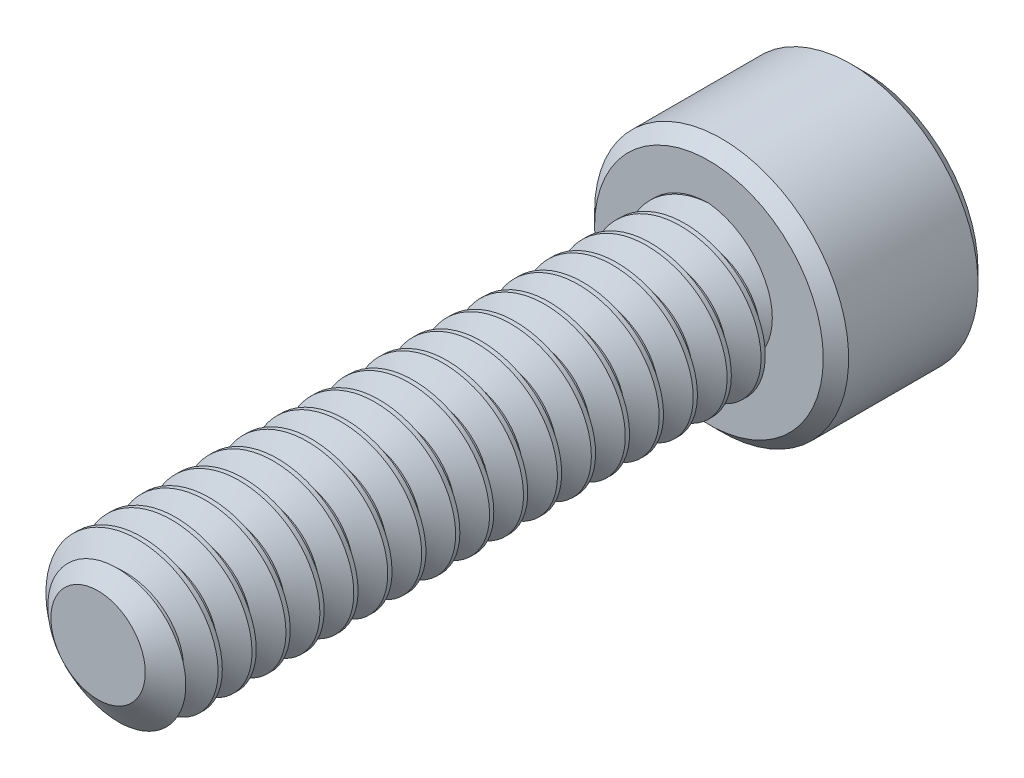
from build123d import *

# Parameters (mm, degrees)
SKETCH1_R          = 2.413
EXTRUDE1_DEPTH     = 19.05
CUT_SWEEP1_PITCH   = 1.058333333
SKETCH6_R          = 3.9624
EXTRUDE2_DEPTH     = 4.826
CUT_EXTRUDE1_DEPTH = 2.9765625
CHAMFER1_SIZE      = 0.39624


with BuildPart() as part:
    # Sketch1 → Extrude1 (new body)
    with BuildSketch(Plane.XY):
        Circle(SKETCH1_R)
    extrude(amount=-EXTRUDE1_DEPTH)

    # Cut-Sweep1: the profile of Sketch3 profile screwed along a right-hand helix of 19 turns, 6 arcs to a turn; built about Z, then put on its axis
    cut_sweep1_z = Axis((0, 0, 0), (0, 0, 1))
    cut_sweep1_corners = [(2.4133, 0, -0.926214872), (1.725592336, 0, -0.529166667), (1.725592336, 0, -0.396875), (2.4133, 0, 0.000173205)]
    with BuildLine(mode=Mode.PRIVATE) as cut_sweep1_profile:
        Line(cut_sweep1_corners[0], cut_sweep1_corners[1])
        Line(cut_sweep1_corners[1], cut_sweep1_corners[2])
        Line(cut_sweep1_corners[2], cut_sweep1_corners[3])
        Line(cut_sweep1_corners[3], cut_sweep1_corners[0])
    cut_sweep1_cap = Face(cut_sweep1_profile.wire())
    cut_sweep1_turn_angles = [0, 30, 60, 90, 120, 150, 180, 210, 240, 270, 300, 330, 360]
    cut_sweep1_turn_weights = [1, 0.8660254037844387, 1, 0.8660254037844387, 1, 0.8660254037844387, 1, 0.8660254037844387, 1, 0.8660254037844387, 1, 0.8660254037844387, 1]
    cut_sweep1_turn_rails = [Edge.make_bspline([Vector(p[0], p[1], 0).rotate(cut_sweep1_z, cut_sweep1_turn_angles[k]) / cut_sweep1_turn_weights[k] + Vector(0, 0, p[2] + CUT_SWEEP1_PITCH * cut_sweep1_turn_angles[k] / 360) for k in range(13)], [0, 0, 0, 1, 1, 2, 2, 3, 3, 4, 4, 5, 5, 6, 6, 6], 2, cut_sweep1_turn_weights) for p in cut_sweep1_corners]
    cut_sweep1_turn_sides = [Face.make_surface_from_curves(cut_sweep1_turn_rails[p[0]], cut_sweep1_turn_rails[p[1]]) for p in [(0, 1), (1, 2), (2, 3), (3, 0)]]
    cut_sweep1 = Plane(origin=(0, 0, 0), x_dir=(0, 1, 0), z_dir=(0, 0, -1)) * Solid(Shell([*[p.moved(Location((0, 0, CUT_SWEEP1_PITCH * i))) for i in range(19) for p in cut_sweep1_turn_sides], cut_sweep1_cap, cut_sweep1_cap.rotate(cut_sweep1_z, 6840).moved(Location((0, 0, CUT_SWEEP1_PITCH * 6840 / 360)))]))
    add(cut_sweep1, mode=Mode.SUBTRACT)

    # Sketch4 → Cut-Revolve1 (revolve, cut)
    with BuildSketch(Plane(origin=(0, 0, 0), x_dir=(0, 0, -1), z_dir=(1, 0, 0)), mode=Mode.PRIVATE) as cut_revolve1_sk:
        Polygon((0.659180743, 2.413), (0, 1.471592336), (0, 2.413), align=None)
    revolve(cut_revolve1_sk.sketch.rotate(Axis((0, 0, 0), (0, 0, -1)), 240.547545651), axis=Axis((0, 0, 0), (0, 0, -1)), mode=Mode.SUBTRACT)

    # Sketch6 → Extrude2 (add)
    with BuildSketch(Plane(origin=(0, 0, -19.05), x_dir=(-1, 0, 0), z_dir=(0, 0, -1))):
        Circle(SKETCH6_R)
    extrude(amount=EXTRUDE2_DEPTH)

    # Sketch7 → Cut-Extrude1 (cut)
    with BuildSketch(Plane(origin=(0, 0, -23.876), x_dir=(-1, 0, 0), z_dir=(0, 0, -1))):
        Polygon((0, 2.291358881), (-1.984375, 1.14567944), (-1.984375, -1.14567944), (0, -2.291358881), (1.984375, -1.14567944), (1.984375, 1.14567944), align=None)
    extrude(amount=-CUT_EXTRUDE1_DEPTH, mode=Mode.SUBTRACT)

    # Cut-Extrude2 cone 1 section (through the dimple's axis) → Cut-Extrude2 (revolve, cut)
    with BuildSketch(Plane(origin=(0, 0, -23.876), x_dir=(0, 1, 0), z_dir=(1, 0, 0))):
        Polygon((0, 0), (2.291358881, 0), (0, 2.291358881), align=None)
    revolve(axis=Axis((0, 0, -23.876), (0, 0, 1)), mode=Mode.SUBTRACT)

    # Chamfer1
    chamfer1_edges = [part.edges().sort_by_distance(p)[0] for p in [
        (3.9624, 0, -19.05),
        (3.9624, 0, -23.876),
    ]]
    chamfer(chamfer1_edges, length=CHAMFER1_SIZE)


solid = part.part
